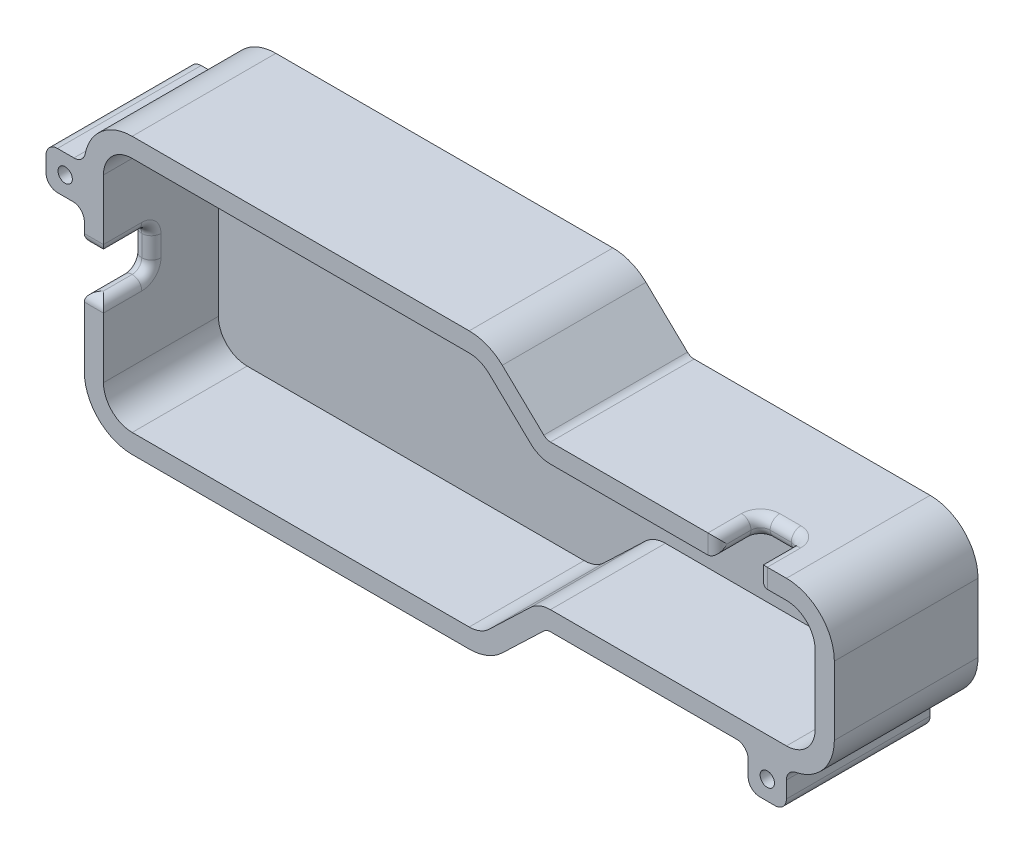
from build123d import *

# Parameters (mm, degrees)
BOSS_EXTRUDE2_DEPTH      = 12
BOSS_EXTRUDE2_DEPTH_BACK = 3
BOSS_EXTRUDE3_DEPTH      = 3
SKETCH6_W                = 5
SKETCH6_H                = 2.1
CUT_EXTRUDE1_DEPTH       = 10
SKETCH7_W                = 4.2
SKETCH7_H                = 4.5
CUT_EXTRUDE2_DEPTH       = 10
FILLET1_R                = 1
SKETCH8_W                = 4
SKETCH8_H                = 4
BOSS_EXTRUDE4_DEPTH      = 15
FILLET2_R                = 1.2
SKETCH9_R                = 0.75
CUT_EXTRUDE3_DEPTH       = 83.553600769
SKETCH10_R               = 3.5
CUT_EXTRUDE4_DEPTH       = 1.5
FILLET3_R                = 0.3


with BuildPart() as part:
    # Sketch3 → Boss-Extrude2 (new, two sides: drawn at the far end of the back side and taken through both)
    with BuildSketch(Plane.XY.offset(-BOSS_EXTRUDE2_DEPTH_BACK)):
        with BuildLine():
            Line((-69.81, 19.47), (-34.625063383, 19.47))
            ThreePointArc((-34.625063383, 19.47), (-32.763487521, 19.110531791), (-31.169582594, 18.083814123))
            Line((-31.169582594, 18.083814123), (-26.833005647, 13.937237175))
            ThreePointArc((-26.833005647, 13.937237175), (-26.514224661, 13.731893642), (-26.141909489, 13.66))
            Line((-26.141909489, 13.66), (-1.5, 13.66))
            ThreePointArc((-1.5, 13.66), (2.035533906, 12.195533906), (3.5, 8.66))
            Line((3.5, 8.66), (3.5, 1.5))
            ThreePointArc((3.5, 1.5), (2.035533906, -2.035533906), (-1.5, -3.5))
            Line((-1.5, -3.5), (-26.141909489, -3.5))
            ThreePointArc((-26.141909489, -3.5), (-26.514224661, -3.571893642), (-26.833005647, -3.777237175))
            Line((-26.833005647, -3.777237175), (-31.169582594, -7.923814123))
            ThreePointArc((-31.169582594, -7.923814123), (-32.763487521, -8.950531791), (-34.625063383, -9.31))
            Line((-34.625063383, -9.31), (-69.81, -9.31))
            ThreePointArc((-69.81, -9.31), (-73.345533906, -7.845533906), (-74.81, -4.31))
            Line((-74.81, -4.31), (-74.81, 14.47))
            ThreePointArc((-74.81, 14.47), (-73.345533906, 18.005533906), (-69.81, 19.47))
        make_face()
        with BuildLine():
            Line((-69.81, 17.47), (-34.625063383, 17.47))
            ThreePointArc((-34.625063383, 17.47), (-33.508117866, 17.254319075), (-32.55177491, 16.638288474))
            Line((-32.55177491, 16.638288474), (-28.215197962, 12.491711526))
            ThreePointArc((-28.215197962, 12.491711526), (-27.258855006, 11.875680925), (-26.141909489, 11.66))
            Line((-26.141909489, 11.66), (-1.5, 11.66))
            ThreePointArc((-1.5, 11.66), (0.621320344, 10.781320344), (1.5, 8.66))
            Line((1.5, 8.66), (1.5, 1.5))
            ThreePointArc((1.5, 1.5), (0.621320344, -0.621320344), (-1.5, -1.5))
            Line((-1.5, -1.5), (-26.141909489, -1.5))
            ThreePointArc((-26.141909489, -1.5), (-27.258855006, -1.715680925), (-28.215197962, -2.331711526))
            Line((-28.215197962, -2.331711526), (-32.55177491, -6.478288474))
            ThreePointArc((-32.55177491, -6.478288474), (-33.508117866, -7.094319075), (-34.625063383, -7.31))
            Line((-34.625063383, -7.31), (-69.81, -7.31))
            ThreePointArc((-69.81, -7.31), (-71.931320344, -6.431320344), (-72.81, -4.31))
            Line((-72.81, -4.31), (-72.81, 14.47))
            ThreePointArc((-72.81, 14.47), (-71.931320344, 16.591320344), (-69.81, 17.47))
        make_face(mode=Mode.SUBTRACT)
    extrude(amount=BOSS_EXTRUDE2_DEPTH + BOSS_EXTRUDE2_DEPTH_BACK)

    # Sketch5 → Boss-Extrude3 (add)
    with BuildSketch(Plane(origin=(0, 0, -3), x_dir=(-1, 0, 0), z_dir=(0, 0, -1))):
        with BuildLine():
            Line((72.81, 14.47), (72.81, -4.31))
            ThreePointArc((72.81, -4.31), (71.931320344, -6.431320344), (69.81, -7.31))
            Line((69.81, -7.31), (34.625063383, -7.31))
            ThreePointArc((34.625063383, -7.31), (33.508117866, -7.094319075), (32.55177491, -6.478288474))
            Line((32.55177491, -6.478288474), (28.215197962, -2.331711526))
            ThreePointArc((28.215197962, -2.331711526), (27.258855006, -1.715680925), (26.141909489, -1.5))
            Line((26.141909489, -1.5), (1.5, -1.5))
            ThreePointArc((1.5, -1.5), (-0.621320344, -0.621320344), (-1.5, 1.5))
            Line((-1.5, 1.5), (-1.5, 8.66))
            ThreePointArc((-1.5, 8.66), (-0.621320344, 10.781320344), (1.5, 11.66))
            Line((1.5, 11.66), (26.141909489, 11.66))
            ThreePointArc((26.141909489, 11.66), (27.258855006, 11.875680925), (28.215197962, 12.491711526))
            Line((28.215197962, 12.491711526), (32.55177491, 16.638288474))
            ThreePointArc((32.55177491, 16.638288474), (33.508117866, 17.254319075), (34.625063383, 17.47))
            Line((34.625063383, 17.47), (69.81, 17.47))
            ThreePointArc((69.81, 17.47), (71.931320344, 16.591320344), (72.81, 14.47))
        make_face()
    extrude(amount=-BOSS_EXTRUDE3_DEPTH)

    # Sketch6 → Cut-Extrude1 (cut)
    with BuildSketch(Plane.ZY.offset(74.81)):
        with Locations((9.5, 6.13)):
            Rectangle(SKETCH6_W, SKETCH6_H)
        with Locations((9.5, 4.03)):
            Rectangle(SKETCH6_W, SKETCH6_H)
    extrude(amount=-CUT_EXTRUDE1_DEPTH, mode=Mode.SUBTRACT)

    # Sketch7 → Cut-Extrude2 (cut)
    with BuildSketch(Plane(origin=(0, 13.66, 0), x_dir=(1, 0, 0), z_dir=(0, 1, 0))):
        with Locations((-6.6, -9.75)):
            Rectangle(SKETCH7_W, SKETCH7_H)
    extrude(amount=-CUT_EXTRUDE2_DEPTH, mode=Mode.SUBTRACT)

    # Fillet1
    fillet1_edges = [part.edges().sort_by_distance(p)[0] for p in [
        (-73.81, 2.98, 12),
        (-73.81, 7.18, 12),
        (-72.81, 5.08, 7),
        (-73.81, 2.98, 7),
        (-73.81, 7.18, 7),
        (-74.81, 7.18, 9.5),
        (-72.81, 2.98, 9.5),
        (-72.81, 7.18, 9.5),
        (-74.81, 5.08, 7),
        (-74.81, 2.98, 9.5),
        (-4.5, 12.66, 12),
        (-8.7, 11.66, 9.75),
        (-8.7, 12.66, 12),
        (-6.6, 11.66, 7.5),
        (-8.7, 12.66, 7.5),
        (-4.5, 11.66, 9.75),
        (-4.5, 12.66, 7.5),
        (-4.5, 13.66, 9.75),
        (-6.6, 13.66, 7.5),
        (-8.7, 13.66, 9.75),
    ]]
    fillet(fillet1_edges, radius=FILLET1_R - 0.0001)  # a hair under: the kernel refuses the full size

    # Sketch8 → Boss-Extrude4 (add, through all)
    with BuildSketch(Plane.XY.offset(12)):
        with Locations((-76.81, 12.47)):
            Rectangle(SKETCH8_W, SKETCH8_H)
        with Locations((-3.5, -5.5)):
            Rectangle(SKETCH8_W, SKETCH8_H)
    extrude(amount=-BOSS_EXTRUDE4_DEPTH)

    # Fillet2
    fillet2_edges = [part.edges().sort_by_distance(p)[0] for p in [
        (-1.5, -3.5, 4.5),
        (-74.81, 14.47, 4.5),
        (-74.81, 10.47, 4.5),
        (-78.81, 10.47, 4.5),
        (-78.81, 14.47, 4.5),
        (-1.5, -7.5, 4.5),
        (-5.5, -7.5, 4.5),
        (-5.5, -3.5, 4.5),
    ]]
    fillet(fillet2_edges, radius=FILLET2_R)

    # Sketch9 → Cut-Extrude3 (cut, through all)
    with BuildSketch(Plane.XY.offset(12)):
        with Locations((-76.81, 12.47)):
            Circle(SKETCH9_R)
        with Locations((-3.5, -5.5)):
            Circle(SKETCH9_R)
    extrude(amount=-CUT_EXTRUDE3_DEPTH, mode=Mode.SUBTRACT)

    # Sketch10 → Cut-Extrude4 (cut)
    with BuildSketch(Plane(origin=(0, 0, -3), x_dir=(-1, 0, 0), z_dir=(0, 0, -1))):
        with Locations((62.81, 5.08)):
            Circle(SKETCH10_R)
    extrude(amount=-CUT_EXTRUDE4_DEPTH, mode=Mode.SUBTRACT)

    # Fillet3
    fillet3_edges = [part.edges().sort_by_distance(p)[0] for p in [
        (-59.31, 5.08, -3),
    ]]
    fillet(fillet3_edges, radius=FILLET3_R)


solid = part.part
